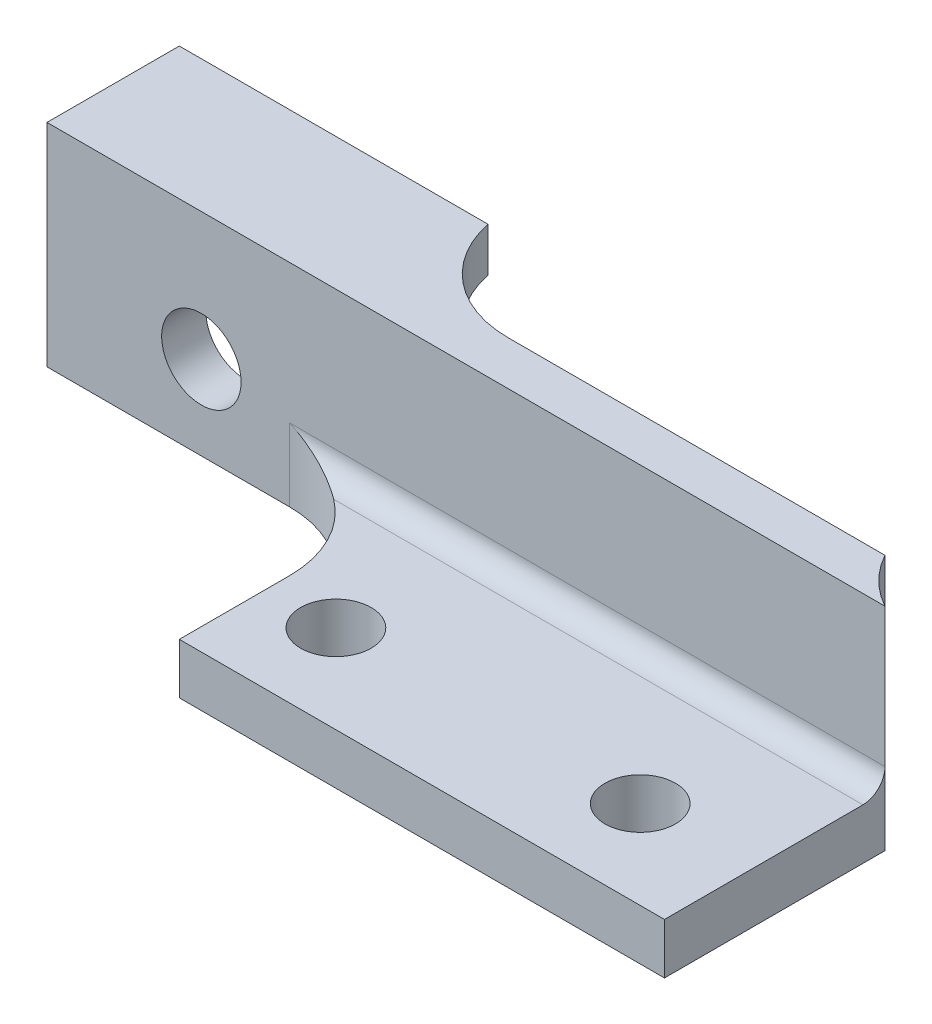
from build123d import *

# Parameters (mm, degrees)
CROQUIS1_W              = 2
CROQUIS1_H              = 2
CROQUIS1_W_2            = 4
SALIENTE_EXTRUIR1_DEPTH = 14
CROQUIS1_3_W            = 2
CROQUIS1_3_H            = 2
SALIENTE_EXTRUIR2_DEPTH = 22
CORTAR_EXTRUIR1_DEPTH   = 2
CROQUIS2_3_W            = 18
CROQUIS2_3_H            = 2.3
CROQUIS2_3_W_2          = 2
SALIENTE_EXTRUIR3_DEPTH = 10
CROQUIS3_R              = 1.6
CORTAR_EXTRUIR2_DEPTH   = 2.3
REDONDEO1_R             = 5
REDONDEO4_START         = -3.8
REDONDEO4_DEPTH         = 9.6
REDONDEO5_R             = 1
REDONDEO6_R             = 5


with BuildPart() as part:
    # Croquis1 → Saliente-Extruir1 (new body)
    with BuildSketch(Plane(origin=(0, 0, 0), x_dir=(0, 0, -1), z_dir=(1, 0, 0))):
        Polygon((0, -3.8), (0, 0), (0, 3.8), (-2, 3.8), (-2, -3.8), align=None)
        with Locations((-1, 4.8)):
            Rectangle(CROQUIS1_W, CROQUIS1_H)
        with Locations((2, 4.8)):
            Rectangle(CROQUIS1_W_2, CROQUIS1_H)
    extrude(amount=-SALIENTE_EXTRUIR1_DEPTH)

    # Croquis1<3> → Saliente-Extruir2 (add)
    with BuildSketch(Plane(origin=(0, 0, 0), x_dir=(0, 0, -1), z_dir=(1, 0, 0))):
        Polygon((0, -3.8), (0, 0), (0, 3.8), (-2, 3.8), (-2, -3.8), align=None)
        with Locations((-1, 4.8)):
            Rectangle(CROQUIS1_3_W, CROQUIS1_3_H)
    extrude(amount=SALIENTE_EXTRUIR2_DEPTH)

    # Croquis2 → Cortar-Extruir1 (cut)
    with BuildSketch(Plane.XY.offset(2)):
        with BuildLine():
            ThreePointArc((-8.8, 0), (-7, -1.8), (-5.2, 0))
            Line((-5.2, 0), (-8.8, 0))
        make_face()
        with BuildLine():
            Line((-8.8, 0), (-5.2, 0))
            ThreePointArc((-5.2, 0), (-7, 1.8), (-8.8, 0))
        make_face()
    extrude(amount=-CORTAR_EXTRUIR1_DEPTH, mode=Mode.SUBTRACT)

    # Croquis2<3> → Saliente-Extruir3 (add)
    with BuildSketch(Plane.XY.offset(2)):
        with Locations((13, -2.65)):
            Rectangle(CROQUIS2_3_W, CROQUIS2_3_H)
        with Locations((3, -2.65)):
            Rectangle(CROQUIS2_3_W_2, CROQUIS2_3_H)
        with Locations((23, -2.65)):
            Rectangle(CROQUIS2_3_W_2, CROQUIS2_3_H)
    extrude(amount=SALIENTE_EXTRUIR3_DEPTH)

    # Croquis3 → Cortar-Extruir2 (cut)
    with BuildSketch(Plane(origin=(0, -1.5, 0), x_dir=(1, 0, 0), z_dir=(0, 1, 0))):
        with Locations(Location((5.1, -8, 0), (0, 0, 180))):
            Circle(CROQUIS3_R)
        with Locations(Location((18.9, -8, 0), (0, 0, 180))):
            Circle(CROQUIS3_R)
    extrude(amount=-CORTAR_EXTRUIR2_DEPTH, mode=Mode.SUBTRACT)

    # Redondeo1
    # the kernel refuses this fillet: 5 mm, written as the material it adds along each edge
    with BuildSketch(Plane(origin=(0, 3.8, 0), x_dir=(1, 0, 0), z_dir=(0, 1, 0))) as redondeo1_piece_1:
        with BuildLine():
            CenterArc((4.898979486, 5), REDONDEO1_R, 191.536959033, 78.463040967)
            Line((0, 4), (-0.09797959, 3.98))
            ThreePointArc((-0.09797959, 3.98), (-0.1, 2), (-0.1, 0))
            Line((-0.1, 0), (0, -0.1))
            Line((0, -0.1), (4.898979486, -0.1))
            Line((4.898979486, -0.1), (4.898979486, 0))
        make_face()
    extrude(amount=2)

    # Redondeo4: read off the stored shape, not the designer's step
    # Redondeo4 outline → Redondeo4 (add)
    with BuildSketch(Plane(origin=(0, 0, 0), x_dir=(1, 0, 0), z_dir=(0, 1, 0)).offset(REDONDEO4_START)):
        with BuildLine():
            ThreePointArc((24, -2), (22.855631086, -1.144368914), (22, 0))
            Line((22, 0), (22, -2))
            Line((22, -2), (24, -2))
        make_face()
    extrude(amount=REDONDEO4_DEPTH)

    # Redondeo5
    redondeo5_edges = [part.edges().sort_by_distance(p)[0] for p in [
        (13, -1.5, 2),
    ]]
    fillet(redondeo5_edges, radius=REDONDEO5_R)

    # Redondeo6
    redondeo6_edges = [part.edges().sort_by_distance(p)[0] for p in [
        (2, -2.15, 2),
    ]]
    fillet(redondeo6_edges, radius=REDONDEO6_R)


solid = part.part
